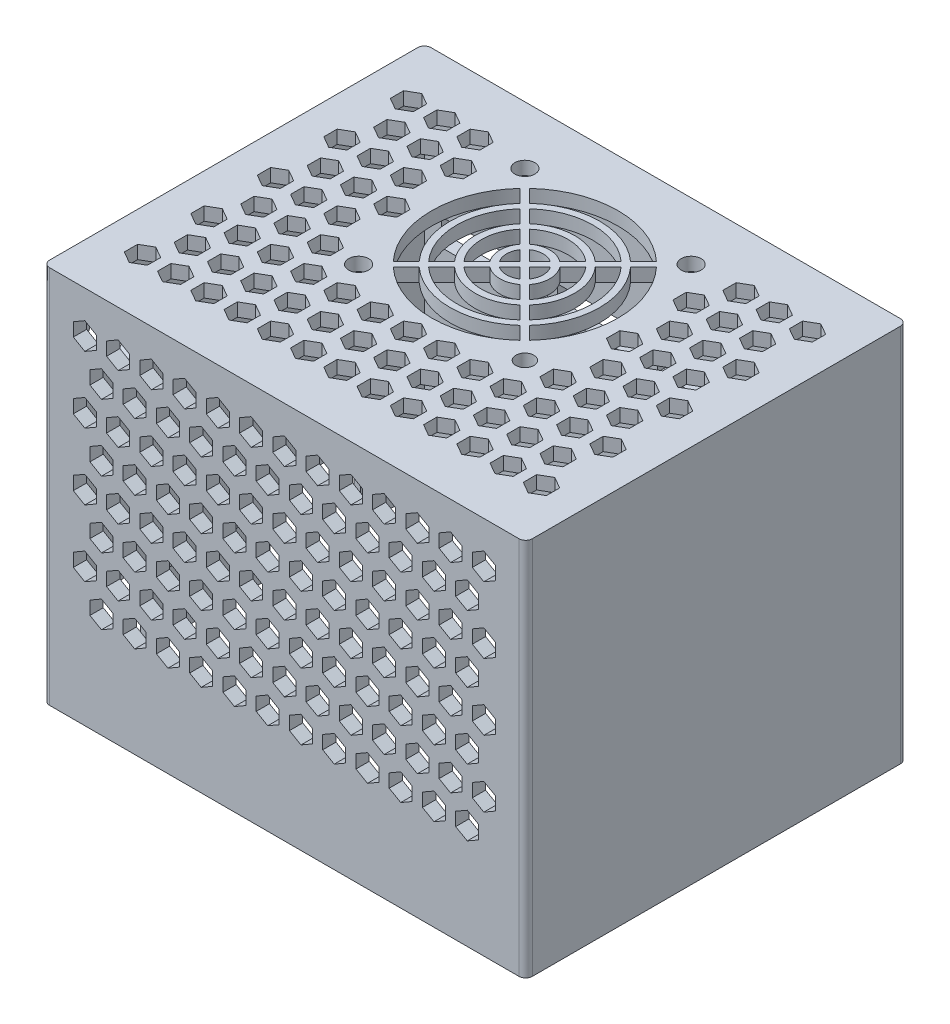
from build123d import *

# Parameters (mm, degrees)
SKETCH1_W            = 72.58
SKETCH1_H            = 57.34
SKETCH1_W_2          = 68.58
SKETCH1_H_2          = 53.34
BOSS_EXTRUDE1_DEPTH  = 55
SKETCH2_W            = 72.58
SKETCH2_H            = 57.34
BOSS_EXTRUDE2_DEPTH  = 2
SKETCH3_W            = 70.58
SKETCH3_H            = 55.34
SKETCH3_W_2          = 68.58
SKETCH3_H_2          = 53.34
CUT_EXTRUDE1_DEPTH   = 10
SKETCH5_W            = 13.6
SKETCH5_H            = 13.6
SKETCH5_W_2          = 11
SKETCH5_H_2          = 13
CUT_EXTRUDE2_DEPTH   = 74.402540828
CUT_EXTRUDE3_DEPTH   = 74.402540828
CUT_EXTRUDE4_DEPTH   = 74.402540828
SKETCH10_R           = 1.5
SKETCH10_R_2         = 1.35
CUT_EXTRUDE5_DEPTH   = 74.402540828
LPATTERN2_COUNT      = 13
LPATTERN2_PITCH      = 5
LPATTERN2_COUNT_DIR2 = 5
LPATTERN2_PITCH_DIR2 = 10
LPATTERN3_COUNT      = 12
LPATTERN3_PITCH      = 5
LPATTERN3_COUNT_DIR2 = 4
LPATTERN3_PITCH_DIR2 = 10
FILLET2_R            = 1
SKETCH14_R           = 5
CUT_EXTRUDE7_DEPTH   = 3
CUT_EXTRUDE8_START   = -2
CUT_EXTRUDE8_DEPTH   = 87.621891765
LPATTERN4_COUNT      = 13
LPATTERN4_PITCH      = 5
LPATTERN4_COUNT_DIR2 = 4
LPATTERN4_PITCH_DIR2 = 10
CUT_EXTRUDE9_START   = -2
CUT_EXTRUDE9_DEPTH   = 87.621891765
LPATTERN5_COUNT      = 12
LPATTERN5_PITCH      = 5
LPATTERN5_COUNT_DIR2 = 4
LPATTERN5_PITCH_DIR2 = 10
SKETCH16_W           = 15.964101616
SKETCH16_H           = 4
SKETCH16_W_2         = 13.464101616
CUT_EXTRUDE10_DEPTH  = 3


with BuildPart() as part:
    # Sketch1 → Boss-Extrude1 (new body)
    with BuildSketch(Plane(origin=(0, 0, 0), x_dir=(1, 0, 0), z_dir=(0, 1, 0))):
        Rectangle(SKETCH1_W, SKETCH1_H)
        Rectangle(SKETCH1_W_2, SKETCH1_H_2, mode=Mode.SUBTRACT)
    extrude(amount=BOSS_EXTRUDE1_DEPTH)

    # Sketch2 → Boss-Extrude2 (add)
    with BuildSketch(Plane(origin=(0, 55, 0), x_dir=(1, 0, 0), z_dir=(0, 1, 0))):
        Rectangle(SKETCH2_W, SKETCH2_H)
    extrude(amount=BOSS_EXTRUDE2_DEPTH)

    # Sketch3 → Cut-Extrude1 (cut)
    with BuildSketch(Plane.XZ):
        Rectangle(SKETCH3_W, SKETCH3_H)
        Rectangle(SKETCH3_W_2, SKETCH3_H_2, mode=Mode.SUBTRACT)
    extrude(amount=-CUT_EXTRUDE1_DEPTH, mode=Mode.SUBTRACT)

    # Sketch5 → Cut-Extrude2 (cut, through all)
    with BuildSketch(Plane(origin=(0, 0, 0), x_dir=(0, 0, -1), z_dir=(1, 0, 0))):
        with Locations((11.29, 5.18)):
            Rectangle(SKETCH5_W, SKETCH5_H)
        with Locations((-19.52, 5.5)):
            Rectangle(SKETCH5_W_2, SKETCH5_H_2)
    extrude(amount=-CUT_EXTRUDE2_DEPTH, mode=Mode.SUBTRACT)

    # Sketch8 → Cut-Extrude3 (cut, through all)
    with BuildSketch(Plane(origin=(0, 57, 0), x_dir=(1, 0, 0), z_dir=(0, 1, 0))):
        Polygon((-28.267949192, 21), (-30, 22), (-31.732050808, 21), (-31.732050808, 19), (-30, 18), (-28.267949192, 19), align=None)
    cut_extrude3 = extrude(amount=-CUT_EXTRUDE3_DEPTH, mode=Mode.SUBTRACT)

    # Sketch9 → Cut-Extrude4 (cut, through all)
    with BuildSketch(Plane(origin=(0, 57, 0), x_dir=(1, 0, 0), z_dir=(0, 1, 0))):
        Polygon((-25.767949192, 14), (-25.767949192, 16), (-27.5, 17), (-29.232050808, 16), (-29.232050808, 14), (-27.5, 13), align=None)
    cut_extrude4 = extrude(amount=-CUT_EXTRUDE4_DEPTH, mode=Mode.SUBTRACT)

    # Sketch10 → Cut-Extrude5 (cut, through all)
    with BuildSketch(Plane(origin=(0, 57, 0), x_dir=(1, 0, 0), z_dir=(0, 1, 0))):
        with Locations(Location((-12.5, 20, 0), (0, 0, 270))):
            Circle(SKETCH10_R)
        with Locations(Location((12.5, 20, 0), (0, 0, 270))):
            Circle(SKETCH10_R)
        with Locations(Location((12.5, -5, 0), (0, 0, 270))):
            Circle(SKETCH10_R_2)
        with Locations(Location((-12.5, -5, 0), (0, 0, 270))):
            Circle(SKETCH10_R)
        with BuildLine():
            Line((-8.300644053, 15.093537272), (-10.246732859, 17.039626078))
            ThreePointArc((-10.246732859, 17.039626078), (-14, 7.5), (-10.246732859, -2.039626078))
            Line((-10.246732859, -2.039626078), (-8.300644053, -0.093537272))
            ThreePointArc((-8.300644053, -0.093537272), (-11.25, 7.5), (-8.300644053, 15.093537272))
        make_face()
        with BuildLine():
            Line((-7.592769508, 14.385662727), (-5.645056013, 12.437949232))
            ThreePointArc((-5.645056013, 12.437949232), (-7.5, 7.5), (-5.645056013, 2.562050768))
            Line((-5.645056013, 2.562050768), (-7.592769508, 0.614337273))
            ThreePointArc((-7.592769508, 0.614337273), (-10.25, 7.5), (-7.592769508, 14.385662727))
        make_face()
        with BuildLine():
            Line((-4.936129086, 11.729022304), (-2.981527896, 9.774421115))
            ThreePointArc((-2.981527896, 9.774421115), (-3.75, 7.5), (-2.981527896, 5.225578885))
            Line((-2.981527896, 5.225578885), (-4.936129086, 3.270977696))
            ThreePointArc((-4.936129086, 3.270977696), (-6.5, 7.5), (-4.936129086, 11.729022304))
        make_face()
        with BuildLine():
            Line((2.274421115, 10.481527896), (4.229022304, 12.436129086))
            ThreePointArc((4.229022304, 12.436129086), (0, 14), (-4.229022304, 12.436129086))
            Line((-4.229022304, 12.436129086), (-2.274421115, 10.481527896))
            ThreePointArc((-2.274421115, 10.481527896), (0, 11.25), (2.274421115, 10.481527896))
        make_face()
        with BuildLine():
            Line((4.937949232, 13.145056013), (6.885662727, 15.092769508))
            ThreePointArc((6.885662727, 15.092769508), (0, 17.75), (-6.885662727, 15.092769508))
            Line((-6.885662727, 15.092769508), (-4.937949232, 13.145056013))
            ThreePointArc((-4.937949232, 13.145056013), (0, 15), (4.937949232, 13.145056013))
        make_face()
        with BuildLine():
            ThreePointArc((9.539626078, 17.746732859), (0, 21.5), (-9.539626078, 17.746732859))
            Line((-9.539626078, 17.746732859), (-7.593537272, 15.800644053))
            ThreePointArc((-7.593537272, 15.800644053), (0, 18.75), (7.593537272, 15.800644053))
            Line((7.593537272, 15.800644053), (9.539626078, 17.746732859))
        make_face()
        with BuildLine():
            ThreePointArc((5.645056013, 2.562050768), (7.5, 7.5), (5.645056013, 12.437949232))
            Line((5.645056013, 12.437949232), (7.592769508, 14.385662727))
            ThreePointArc((7.592769508, 14.385662727), (10.25, 7.5), (7.592769508, 0.614337273))
            Line((7.592769508, 0.614337273), (5.645056013, 2.562050768))
        make_face()
        with BuildLine():
            Line((2.981527896, 5.225578885), (4.936129086, 3.270977696))
            ThreePointArc((4.936129086, 3.270977696), (6.5, 7.5), (4.936129086, 11.729022304))
            Line((4.936129086, 11.729022304), (2.981527896, 9.774421115))
            ThreePointArc((2.981527896, 9.774421115), (3.75, 7.5), (2.981527896, 5.225578885))
        make_face()
        with BuildLine():
            ThreePointArc((10.246732859, -2.039626078), (14, 7.5), (10.246732859, 17.039626078))
            Line((10.246732859, 17.039626078), (8.300644053, 15.093537272))
            ThreePointArc((8.300644053, 15.093537272), (11.25, 7.5), (8.300644053, -0.093537272))
            Line((8.300644053, -0.093537272), (10.246732859, -2.039626078))
        make_face()
        with BuildLine():
            Line((-7.593537272, -0.800644053), (-9.539626078, -2.746732859))
            ThreePointArc((-9.539626078, -2.746732859), (0, -6.5), (9.539626078, -2.746732859))
            Line((9.539626078, -2.746732859), (7.593537272, -0.800644053))
            ThreePointArc((7.593537272, -0.800644053), (0, -3.75), (-7.593537272, -0.800644053))
        make_face()
        with BuildLine():
            ThreePointArc((-4.937949232, 1.854943987), (0, 0), (4.937949232, 1.854943987))
            Line((4.937949232, 1.854943987), (6.885662727, -0.092769508))
            ThreePointArc((6.885662727, -0.092769508), (0, -2.75), (-6.885662727, -0.092769508))
            Line((-6.885662727, -0.092769508), (-4.937949232, 1.854943987))
        make_face()
        with BuildLine():
            ThreePointArc((-2.274421115, 4.518472104), (0, 3.75), (2.274421115, 4.518472104))
            Line((2.274421115, 4.518472104), (4.229022304, 2.563870914))
            ThreePointArc((4.229022304, 2.563870914), (0, 1), (-4.229022304, 2.563870914))
            Line((-4.229022304, 2.563870914), (-2.274421115, 4.518472104))
        make_face()
        with BuildLine():
            Line((-1.558578927, 5.234314292), (0, 6.792893219))
            Line((0, 6.792893219), (1.558578927, 5.234314292))
            ThreePointArc((1.558578927, 5.234314292), (0, 4.75), (-1.558578927, 5.234314292))
        make_face()
        with BuildLine():
            Line((0.707106781, 7.5), (2.265685708, 5.941421073))
            ThreePointArc((2.265685708, 5.941421073), (2.75, 7.5), (2.265685708, 9.058578927))
            Line((2.265685708, 9.058578927), (0.707106781, 7.5))
        make_face()
        with BuildLine():
            Line((0, 8.207106781), (1.558578927, 9.765685708))
            ThreePointArc((1.558578927, 9.765685708), (0, 10.25), (-1.558578927, 9.765685708))
            Line((-1.558578927, 9.765685708), (0, 8.207106781))
        make_face()
        with BuildLine():
            Line((-2.265685708, 9.058578927), (-0.707106781, 7.5))
            Line((-0.707106781, 7.5), (-2.265685708, 5.941421073))
            ThreePointArc((-2.265685708, 5.941421073), (-2.75, 7.5), (-2.265685708, 9.058578927))
        make_face()
    extrude(amount=-CUT_EXTRUDE5_DEPTH, mode=Mode.SUBTRACT)

    # LPattern2: Cut-Extrude3 13 × 5, 21 skipped
    with Locations(*[(i * LPATTERN2_PITCH, 0, j * LPATTERN2_PITCH_DIR2) for i in range(LPATTERN2_COUNT) for j in range(LPATTERN2_COUNT_DIR2) if (i, j) not in ((0, 0), (3, 0), (3, 1), (3, 2), (4, 0), (4, 1), (4, 2), (5, 0), (5, 1), (5, 2), (6, 0), (6, 1), (6, 2), (7, 0), (7, 1), (7, 2), (8, 0), (8, 1), (8, 2), (9, 0), (9, 1), (9, 2))]):
        add(cut_extrude3, mode=Mode.SUBTRACT)

    # LPattern3: Cut-Extrude4 12 × 4, 18 skipped
    with Locations(*[(i * LPATTERN3_PITCH, 0, j * LPATTERN3_PITCH_DIR2) for i in range(LPATTERN3_COUNT) for j in range(LPATTERN3_COUNT_DIR2) if (i, j) not in ((0, 0), (3, 0), (3, 1), (3, 2), (4, 0), (4, 1), (4, 2), (5, 0), (5, 1), (5, 2), (6, 0), (6, 1), (6, 2), (7, 0), (7, 1), (7, 2), (8, 0), (8, 1), (8, 2))]):
        add(cut_extrude4, mode=Mode.SUBTRACT)

    # Fillet2
    fillet2_edges = [part.edges().sort_by_distance(p)[0] for p in [
        (36.29, 28.5, 28.67),
        (-36.29, 28.5, 28.67),
        (-36.29, 28.5, -28.67),
        (36.29, 28.5, -28.67),
    ]]
    fillet(fillet2_edges, radius=FILLET2_R)

    # Sketch14 → Cut-Extrude7 (cut)
    with BuildSketch(Plane.ZY.offset(36.29)):
        with Locations((19.145, 45)):
            Circle(SKETCH14_R)
    extrude(amount=-CUT_EXTRUDE7_DEPTH, mode=Mode.SUBTRACT)

    # Sketch15 → Cut-Extrude8 (cut, through all)
    with BuildSketch(Plane(origin=(0, 0, -28.67), x_dir=(-1, 0, 0), z_dir=(0, 0, -1)).offset(CUT_EXTRUDE8_START)):
        Polygon((-31.732050808, 49.75), (-30, 48.75), (-28.267949192, 49.75), (-28.267949192, 51.75), (-30, 52.75), (-31.732050808, 51.75), align=None)
    cut_extrude8 = extrude(amount=-CUT_EXTRUDE8_DEPTH, mode=Mode.SUBTRACT)

    # LPattern4: Cut-Extrude8 13 × 4
    with Locations(*[(-i * LPATTERN4_PITCH, -j * LPATTERN4_PITCH_DIR2, 0) for i in range(LPATTERN4_COUNT) for j in range(LPATTERN4_COUNT_DIR2) if (i, j) != (0, 0)]):
        add(cut_extrude8, mode=Mode.SUBTRACT)

    # Sketch15<3> → Cut-Extrude9 (cut, through all)
    with BuildSketch(Plane(origin=(0, 0, -28.67), x_dir=(-1, 0, 0), z_dir=(0, 0, -1)).offset(CUT_EXTRUDE9_START)):
        Polygon((-29.232050808, 44.75), (-27.5, 43.75), (-25.767949192, 44.75), (-25.767949192, 46.75), (-27.5, 47.75), (-29.232050808, 46.75), align=None)
    cut_extrude9 = extrude(amount=-CUT_EXTRUDE9_DEPTH, mode=Mode.SUBTRACT)

    # LPattern5: Cut-Extrude9 12 × 4
    with Locations(*[(-i * LPATTERN5_PITCH, -j * LPATTERN5_PITCH_DIR2, 0) for i in range(LPATTERN5_COUNT) for j in range(LPATTERN5_COUNT_DIR2) if (i, j) != (0, 0)]):
        add(cut_extrude9, mode=Mode.SUBTRACT)

    # Sketch16 → Cut-Extrude10 (cut)
    with BuildSketch(Plane(origin=(0, 0, -28.67), x_dir=(-1, 0, 0), z_dir=(0, 0, -1))):
        with Locations((-23.75, 35.75)):
            Rectangle(SKETCH16_W, SKETCH16_H)
        with Locations((-7.5, 35.75)):
            Rectangle(SKETCH16_W_2, SKETCH16_H)
        with Locations((23.75, 35.75)):
            Rectangle(SKETCH16_W, SKETCH16_H)
        with Locations((7.5, 35.75)):
            Rectangle(SKETCH16_W_2, SKETCH16_H)
    extrude(amount=-CUT_EXTRUDE10_DEPTH, mode=Mode.SUBTRACT)


solid = part.part
